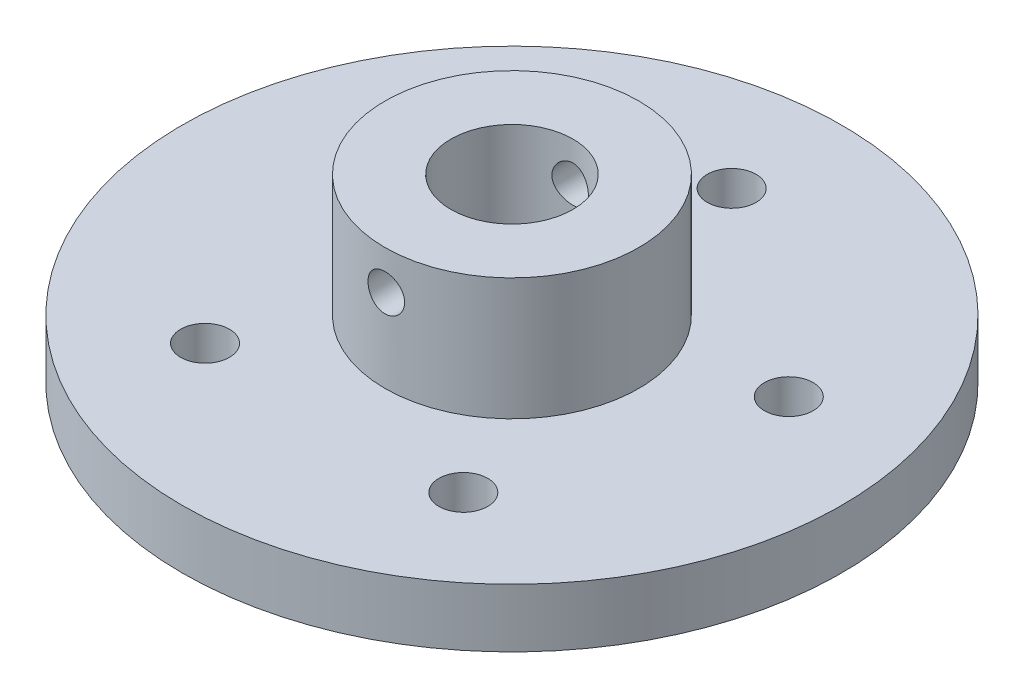
from build123d import *

# Parameters (mm, degrees)
F_1_2_0_5_DIAMETER_HOLE1_D = 12.7
CUT_EXTRUDE1_DEPTH         = 131.021580324
CUT_EXTRUDE1_DEPTH_BACK    = 131.021580324
SKETCH10_R                 = 4.7625


with BuildPart() as part:
    # Sketch1 → Revolve1 (revolve)
    with BuildSketch(Plane.XY):
        Polygon((15.875, 0), (85.725, 0), (85.725, 15.24), (33.02, 15.24), (33.02, 46.99), (15.875, 46.99), align=None)
    revolve(axis=Axis((0, 7.809475806, 0), (0, -1, 0)))

    # 1/2 (0.5) Diameter Hole1 (through all)
    with Locations(Plane(origin=(0, 15.24, 0), x_dir=(1, 0, 0), z_dir=(0, 1, 0))):
        with Locations((-54.352879906, 17.660321229), (0, 57.15), (54.352879906, 17.660321229), (33.591927169, -46.235321229), (-33.591927169, -46.235321229)):
            Hole(F_1_2_0_5_DIAMETER_HOLE1_D / 2)

    # Sketch10 → Cut-Extrude1 (cut, two sides: drawn at the far end of the back side and taken through both)
    with BuildSketch(Plane.XY.offset(-CUT_EXTRUDE1_DEPTH_BACK)):
        with Locations((0, 36.83)):
            Circle(SKETCH10_R)
    extrude(amount=CUT_EXTRUDE1_DEPTH + CUT_EXTRUDE1_DEPTH_BACK, mode=Mode.SUBTRACT)


solid = part.part
